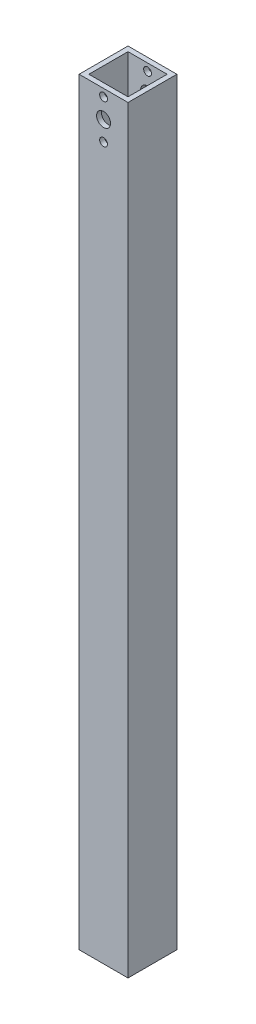
from build123d import *

# Parameters (mm, degrees)
ESBO_O1_W             = 20
ESBO_O1_H             = 20
ESBO_O1_W_2           = 16
ESBO_O1_H_2           = 16
EXTRUS_O_FINA1_DEPTH  = 310
ESBO_O4_R             = 2.85
ESBO_O4_R_2           = 1.6
CORTE_EXTRUS_O2_DEPTH = 312.287648325


with BuildPart() as part:
    # Esboço1 → Extrusão-Fina1 (new body)
    with BuildSketch(Plane(origin=(0, 0, 0), x_dir=(1, 0, 0), z_dir=(0, 1, 0))):
        with Locations((10, 10)):
            Rectangle(ESBO_O1_W, ESBO_O1_H)
        with Locations((10, 10)):
            Rectangle(ESBO_O1_W_2, ESBO_O1_H_2, mode=Mode.SUBTRACT)
    extrude(amount=EXTRUS_O_FINA1_DEPTH)

    # Esboço4 → Corte-extrusão2 (cut, through all)
    with BuildSketch(Plane.XY):
        with Locations((10, 299)):
            Circle(ESBO_O4_R)
        with Locations((10, 291)):
            Circle(ESBO_O4_R_2)
        with Locations((10, 307)):
            Circle(ESBO_O4_R_2)
    extrude(amount=-CORTE_EXTRUS_O2_DEPTH, mode=Mode.SUBTRACT)


solid = part.part
